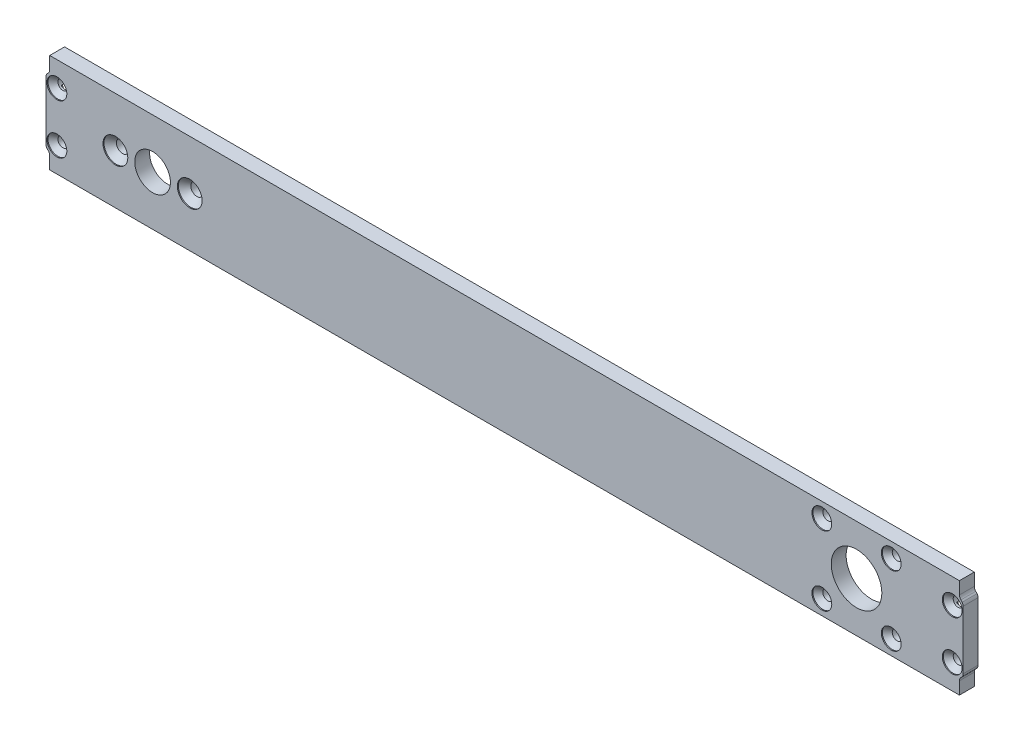
from build123d import *
from build123d.topology import SkipClean

# Parameters (mm, degrees)
SKETCH1_W                    = 185
SKETCH1_H                    = 20
BASE_SHAPE_DEPTH             = 3
MOTOR_CUTOUTS_REACH          = 95.087
SKETCH2_R                    = 1.25
SKETCH2_R_2                  = 3.6
SKETCH2_R_3                  = 5.1
SKETCH2_R_4                  = 1
PCB_SLOT_DEPTH               = 0.775
END_PLATE_HOLES_REACH        = 95.087
SKETCH6_R                    = 1
M2_5_COUNTERSUNKS_AT_2_COUNT = 2
M2_5_COUNTERSUNKS_AT_2_PITCH = 15
M2_COUNTERSUNKS_AT_2_COUNT   = 2
M2_COUNTERSUNKS_AT_2_PITCH   = 10
M2_COUNTERSUNKS_AT_3_COUNT   = 2
M2_COUNTERSUNKS_AT_3_PITCH   = 180.6
M2_COUNTERSUNKS_AT_4_COUNT   = 2
M2_COUNTERSUNKS_AT_4_PITCH   = 180.876643047
M2_COUNTERSUNKS_AT_5_COUNT   = 2
M2_COUNTERSUNKS_AT_5_PITCH   = 17.18400419
M2_COUNTERSUNKS_AT_6_COUNT   = 2
M2_COUNTERSUNKS_AT_6_PITCH   = 28.908303305
M2_COUNTERSUNKS_AT_7_COUNT   = 2
M2_COUNTERSUNKS_AT_7_PITCH   = 26.375936002
M2_COUNTERSUNKS_AT_8_COUNT   = 2
M2_COUNTERSUNKS_AT_8_PITCH   = 12.461540836
TAP_START                    = -1.4
TAP_SLOTS_DEPTH              = 1.4
CUT_EXTRUDE3_REACH           = 95.087
FILLET1_R                    = 1


with BuildPart() as part:
    # Sketch1 → Base shape (new body)
    with BuildSketch(Plane.XY):
        Rectangle(SKETCH1_W, SKETCH1_H)
    extrude(amount=-BASE_SHAPE_DEPTH)

    # Sketch2 → Motor cutouts (cut, up to next)
    with BuildSketch(Plane.XY, mode=Mode.PRIVATE) as motor_cutouts_sk1:
        with Locations((-78.5, 0)):
            Circle(SKETCH2_R)
    motor_cutouts_tool1 = extrude(motor_cutouts_sk1.sketch, amount=-MOTOR_CUTOUTS_REACH, mode=Mode.PRIVATE) & part.part
    # Sketch2 → Motor cutouts (cut, up to next)
    with BuildSketch(Plane.XY, mode=Mode.PRIVATE) as motor_cutouts_sk2:
        with Locations((-63.5, 0)):
            Circle(SKETCH2_R)
    motor_cutouts_tool2 = extrude(motor_cutouts_sk2.sketch, amount=-MOTOR_CUTOUTS_REACH, mode=Mode.PRIVATE) & part.part
    # Sketch2 → Motor cutouts (cut, up to next)
    with BuildSketch(Plane.XY, mode=Mode.PRIVATE) as motor_cutouts_sk3:
        with Locations((-71, 0)):
            Circle(SKETCH2_R_2)
    motor_cutouts_tool3 = extrude(motor_cutouts_sk3.sketch, amount=-MOTOR_CUTOUTS_REACH, mode=Mode.PRIVATE) & part.part
    # Sketch2 → Motor cutouts (cut, up to next)
    with BuildSketch(Plane.XY, mode=Mode.PRIVATE) as motor_cutouts_sk4:
        with Locations((71, 0)):
            Circle(SKETCH2_R_3)
    motor_cutouts_tool4 = extrude(motor_cutouts_sk4.sketch, amount=-MOTOR_CUTOUTS_REACH, mode=Mode.PRIVATE) & part.part
    # Sketch2 → Motor cutouts (cut, up to next)
    with BuildSketch(Plane.XY, mode=Mode.PRIVATE) as motor_cutouts_sk5:
        with Locations((64, 7)):
            Circle(SKETCH2_R_4)
    motor_cutouts_tool5 = extrude(motor_cutouts_sk5.sketch, amount=-MOTOR_CUTOUTS_REACH, mode=Mode.PRIVATE) & part.part
    # Sketch2 → Motor cutouts (cut, up to next)
    with BuildSketch(Plane.XY, mode=Mode.PRIVATE) as motor_cutouts_sk6:
        with Locations((78, 7)):
            Circle(SKETCH2_R_4)
    motor_cutouts_tool6 = extrude(motor_cutouts_sk6.sketch, amount=-MOTOR_CUTOUTS_REACH, mode=Mode.PRIVATE) & part.part
    # Sketch2 → Motor cutouts (cut, up to next)
    with BuildSketch(Plane.XY, mode=Mode.PRIVATE) as motor_cutouts_sk7:
        with Locations((78, -7)):
            Circle(SKETCH2_R_4)
    motor_cutouts_tool7 = extrude(motor_cutouts_sk7.sketch, amount=-MOTOR_CUTOUTS_REACH, mode=Mode.PRIVATE) & part.part
    # Sketch2 → Motor cutouts (cut, up to next)
    with BuildSketch(Plane.XY, mode=Mode.PRIVATE) as motor_cutouts_sk8:
        with Locations((64, -7)):
            Circle(SKETCH2_R_4)
    motor_cutouts_tool8 = extrude(motor_cutouts_sk8.sketch, amount=-MOTOR_CUTOUTS_REACH, mode=Mode.PRIVATE) & part.part
    add(motor_cutouts_tool1.solids().sort_by_distance((-78.5, 0, 0))[0], mode=Mode.SUBTRACT)
    add(motor_cutouts_tool2.solids().sort_by_distance((-63.5, 0, 0))[0], mode=Mode.SUBTRACT)
    add(motor_cutouts_tool3.solids().sort_by_distance((-71, 0, 0))[0], mode=Mode.SUBTRACT)
    add(motor_cutouts_tool4.solids().sort_by_distance((71, 0, 0))[0], mode=Mode.SUBTRACT)
    add(motor_cutouts_tool5.solids().sort_by_distance((64, 7, 0))[0], mode=Mode.SUBTRACT)
    add(motor_cutouts_tool6.solids().sort_by_distance((78, 7, 0))[0], mode=Mode.SUBTRACT)
    add(motor_cutouts_tool7.solids().sort_by_distance((78, -7, 0))[0], mode=Mode.SUBTRACT)
    add(motor_cutouts_tool8.solids().sort_by_distance((64, -7, 0))[0], mode=Mode.SUBTRACT)

    # Sketch5 → PCB slot (cut)
    with BuildSketch(Plane(origin=(0, 0, -3), x_dir=(-1, 0, 0), z_dir=(0, 0, -1))):
        with BuildLine():
            Line((-60, -6), (60, -6))
            ThreePointArc((60, -6), (61, -7), (60, -8))
            Line((60, -8), (-60, -8))
            ThreePointArc((-60, -8), (-61, -7), (-60, -6))
        make_face()
    extrude(amount=-PCB_SLOT_DEPTH, mode=Mode.SUBTRACT)

    # Sketch6 → End plate holes (cut, up to next)
    with BuildSketch(Plane.XY, mode=Mode.PRIVATE) as end_plate_holes_sk1:
        with Locations((90.3, 5)):
            Circle(SKETCH6_R)
    end_plate_holes_tool1 = extrude(end_plate_holes_sk1.sketch, amount=-END_PLATE_HOLES_REACH, mode=Mode.PRIVATE) & part.part
    # Sketch6 → End plate holes (cut, up to next)
    with BuildSketch(Plane.XY, mode=Mode.PRIVATE) as end_plate_holes_sk2:
        with Locations((90.3, -5)):
            Circle(SKETCH6_R)
    end_plate_holes_tool2 = extrude(end_plate_holes_sk2.sketch, amount=-END_PLATE_HOLES_REACH, mode=Mode.PRIVATE) & part.part
    # Sketch6 → End plate holes (cut, up to next)
    with BuildSketch(Plane.XY, mode=Mode.PRIVATE) as end_plate_holes_sk3:
        with Locations((-90.3, -5)):
            Circle(SKETCH6_R)
    end_plate_holes_tool3 = extrude(end_plate_holes_sk3.sketch, amount=-END_PLATE_HOLES_REACH, mode=Mode.PRIVATE) & part.part
    # Sketch6 → End plate holes (cut, up to next)
    with BuildSketch(Plane.XY, mode=Mode.PRIVATE) as end_plate_holes_sk4:
        with Locations((-90.3, 5)):
            Circle(SKETCH6_R)
    end_plate_holes_tool4 = extrude(end_plate_holes_sk4.sketch, amount=-END_PLATE_HOLES_REACH, mode=Mode.PRIVATE) & part.part
    add(end_plate_holes_tool1.solids().sort_by_distance((90.3, 5, 0))[0], mode=Mode.SUBTRACT)
    add(end_plate_holes_tool2.solids().sort_by_distance((90.3, -5, 0))[0], mode=Mode.SUBTRACT)
    add(end_plate_holes_tool3.solids().sort_by_distance((-90.3, -5, 0))[0], mode=Mode.SUBTRACT)
    add(end_plate_holes_tool4.solids().sort_by_distance((-90.3, 5, 0))[0], mode=Mode.SUBTRACT)

    # Sketch4 → M2.5 countersunks (revolve, cut)
    with BuildSketch(Plane(origin=(-78.5, 0, 0), x_dir=(0, -1, 0), z_dir=(1, 0, 0))):
        Polygon((0, 0), (0, 3), (1.25, 3), (1.25, 1.45), (2.5, 0.2), (2.5, 0), align=None)
    m2_5_countersunks = revolve(axis=Axis((-78.5, 0, 6.35), (0, 0, -1)), mode=Mode.SUBTRACT)

    # M2.5 countersunks at 2: M2.5 countersunks ×2
    with Locations(*[(i * M2_5_COUNTERSUNKS_AT_2_PITCH, 0, 0) for i in range(1, M2_5_COUNTERSUNKS_AT_2_COUNT)]):
        add(m2_5_countersunks, mode=Mode.SUBTRACT)

    # Sketch9 → M2 countersunks (revolve, cut)
    with BuildSketch(Plane(origin=(90.3, 5, 0), x_dir=(0, -1, 0), z_dir=(1, 0, 0))):
        Polygon((0, 0), (0, 3), (1, 3), (1, 1.2), (2, 0.2), (2, 0), align=None)
    m2_countersunks = revolve(axis=Axis((90.3, 5, 6.35), (0, 0, -1)), mode=Mode.SUBTRACT)

    # M2 countersunks at 2: M2 countersunks ×2
    with Locations(*[(0, -i * M2_COUNTERSUNKS_AT_2_PITCH, 0) for i in range(1, M2_COUNTERSUNKS_AT_2_COUNT)]):
        add(m2_countersunks, mode=Mode.SUBTRACT)

    # M2 countersunks at 3: M2 countersunks ×2
    with Locations(*[(-i * M2_COUNTERSUNKS_AT_3_PITCH, 0, 0) for i in range(1, M2_COUNTERSUNKS_AT_3_COUNT)]):
        add(m2_countersunks, mode=Mode.SUBTRACT)

    # M2 countersunks at 4: M2 countersunks ×2
    with Locations(*[Vector(-0.9984705430039356, -0.055286298062233535, 0) * (i * M2_COUNTERSUNKS_AT_4_PITCH) for i in range(1, M2_COUNTERSUNKS_AT_4_COUNT)]):
        add(m2_countersunks, mode=Mode.SUBTRACT)

    # M2 countersunks at 5: M2 countersunks ×2
    with Locations(*[Vector(-0.7157819483772108, -0.6983238520753275, 0) * (i * M2_COUNTERSUNKS_AT_5_PITCH) for i in range(1, M2_COUNTERSUNKS_AT_5_COUNT)]):
        add(m2_countersunks, mode=Mode.SUBTRACT)

    # M2 countersunks at 6: M2 countersunks ×2
    with Locations(*[Vector(-0.9097732136717974, -0.4151056488236338, 0) * (i * M2_COUNTERSUNKS_AT_6_PITCH) for i in range(1, M2_COUNTERSUNKS_AT_6_COUNT)]):
        add(m2_countersunks, mode=Mode.SUBTRACT)

    # M2 countersunks at 7: M2 countersunks ×2
    with Locations(*[Vector(-0.9971210120337703, 0.07582669293032472, 0) * (i * M2_COUNTERSUNKS_AT_7_PITCH) for i in range(1, M2_COUNTERSUNKS_AT_7_COUNT)]):
        add(m2_countersunks, mode=Mode.SUBTRACT)

    # M2 countersunks at 8: M2 countersunks ×2
    with Locations(*[Vector(-0.9870368489870532, 0.1604937965832608, 0) * (i * M2_COUNTERSUNKS_AT_8_PITCH) for i in range(1, M2_COUNTERSUNKS_AT_8_COUNT)]):
        add(m2_countersunks, mode=Mode.SUBTRACT)

    # Sketch12 → Tap slots (cut)
    with SkipClean():  # the faces are left unmerged after this step: merging them gives an invalid solid
        with BuildSketch(Plane(origin=(0, 0, -3), x_dir=(-1, 0, 0), z_dir=(0, 0, -1)).offset(TAP_START)):
            with BuildLine():
                Line((-91.9, 2.635786438), (-91.9, -2.635786438))
                ThreePointArc((-91.9, -2.635786438), (-92.085607903, -3.793515558), (-91.043923255, -4.33173494))
                ThreePointArc((-91.043923255, -4.33173494), (-91.048881163, -4.337295689), (-91.053797505, -4.342893219))
                Line((-91.053797505, -4.342893219), (-89.546202495, -4.342893219))
                ThreePointArc((-89.546202495, -4.342893219), (-89.551118837, -4.337295689), (-89.556076745, -4.33173494))
                ThreePointArc((-89.556076745, -4.33173494), (-88.514392097, -3.793515558), (-88.7, -2.635786438))
                Line((-88.7, -2.635786438), (-88.7, 2.635786438))
                ThreePointArc((-88.7, 2.635786438), (-88.514392097, 3.793515558), (-89.556076745, 4.33173494))
                ThreePointArc((-89.556076745, 4.33173494), (-89.551118837, 4.337295689), (-89.546202495, 4.342893219))
                Line((-89.546202495, 4.342893219), (-91.053797505, 4.342893219))
                ThreePointArc((-91.053797505, 4.342893219), (-91.048881163, 4.337295689), (-91.043923255, 4.33173494))
                ThreePointArc((-91.043923255, 4.33173494), (-92.085607903, 3.793515558), (-91.9, 2.635786438))
            make_face()
            with BuildLine():
                Line((91.9, -2.635786438), (91.9, 2.635786438))
                ThreePointArc((91.9, 2.635786438), (92.085607903, 3.793515558), (91.043923255, 4.33173494))
                ThreePointArc((91.043923255, 4.33173494), (91.048881163, 4.337295689), (91.053797505, 4.342893219))
                Line((91.053797505, 4.342893219), (89.546202495, 4.342893219))
                ThreePointArc((89.546202495, 4.342893219), (89.551118837, 4.337295689), (89.556076745, 4.33173494))
                ThreePointArc((89.556076745, 4.33173494), (88.514392097, 3.793515558), (88.7, 2.635786438))
                Line((88.7, 2.635786438), (88.7, -2.635786438))
                ThreePointArc((88.7, -2.635786438), (88.514392097, -3.793515558), (89.556076745, -4.33173494))
                ThreePointArc((89.556076745, -4.33173494), (89.551118837, -4.337295689), (89.546202495, -4.342893219))
                Line((89.546202495, -4.342893219), (91.053797505, -4.342893219))
                ThreePointArc((91.053797505, -4.342893219), (91.048881163, -4.337295689), (91.043923255, -4.33173494))
                ThreePointArc((91.043923255, -4.33173494), (92.085607903, -3.793515558), (91.9, -2.635786438))
            make_face()
        extrude(amount=TAP_SLOTS_DEPTH, mode=Mode.SUBTRACT)

    # Sketch13 → Cut-Extrude3 (cut, up to next)
    with BuildSketch(Plane.XY, mode=Mode.PRIVATE) as cut_extrude3_sk1:
        with BuildLine():
            Line((-91.75, 10), (-92.5, 10))
            Line((-92.5, 10), (-92.5, 6.187434209))
            ThreePointArc((-92.5, 6.187434209), (-92.173731748, 6.655031521), (-91.75, 7.036541185))
            Line((-91.75, 7.036541185), (-91.75, 10))
        make_face()
    cut_extrude3_tool1 = extrude(cut_extrude3_sk1.sketch, amount=-CUT_EXTRUDE3_REACH, mode=Mode.PRIVATE) & part.part
    # Sketch13 → Cut-Extrude3 (cut, up to next)
    with BuildSketch(Plane.XY, mode=Mode.PRIVATE) as cut_extrude3_sk2:
        with BuildLine():
            Line((92.5, 10), (91.75, 10))
            Line((91.75, 10), (91.75, 7.036541185))
            ThreePointArc((91.75, 7.036541185), (92.173731748, 6.655031521), (92.5, 6.187434209))
            Line((92.5, 6.187434209), (92.5, 10))
        make_face()
    cut_extrude3_tool2 = extrude(cut_extrude3_sk2.sketch, amount=-CUT_EXTRUDE3_REACH, mode=Mode.PRIVATE) & part.part
    # Sketch13 → Cut-Extrude3 (cut, up to next)
    with BuildSketch(Plane.XY, mode=Mode.PRIVATE) as cut_extrude3_sk3:
        with BuildLine():
            ThreePointArc((-91.75, -7.036541185), (-92.173731748, -6.655031521), (-92.5, -6.187434209))
            Line((-92.5, -6.187434209), (-92.5, -10))
            Line((-92.5, -10), (-91.75, -10))
            Line((-91.75, -10), (-91.75, -7.036541185))
        make_face()
    cut_extrude3_tool3 = extrude(cut_extrude3_sk3.sketch, amount=-CUT_EXTRUDE3_REACH, mode=Mode.PRIVATE) & part.part
    # Sketch13 → Cut-Extrude3 (cut, up to next)
    with BuildSketch(Plane.XY, mode=Mode.PRIVATE) as cut_extrude3_sk4:
        with BuildLine():
            ThreePointArc((92.5, -6.187434209), (92.173731748, -6.655031521), (91.75, -7.036541185))
            Line((91.75, -7.036541185), (91.75, -10))
            Line((91.75, -10), (92.5, -10))
            Line((92.5, -10), (92.5, -6.187434209))
        make_face()
    cut_extrude3_tool4 = extrude(cut_extrude3_sk4.sketch, amount=-CUT_EXTRUDE3_REACH, mode=Mode.PRIVATE) & part.part
    add(cut_extrude3_tool1.solids().sort_by_distance((-92.140588, 8.330084, 0))[0], mode=Mode.SUBTRACT)
    add(cut_extrude3_tool2.solids().sort_by_distance((92.140588, 8.330084, 0))[0], mode=Mode.SUBTRACT)
    add(cut_extrude3_tool3.solids().sort_by_distance((-92.140588, -8.330084, 0))[0], mode=Mode.SUBTRACT)
    add(cut_extrude3_tool4.solids().sort_by_distance((92.140588, -8.330084, 0))[0], mode=Mode.SUBTRACT)

    # Fillet1
    fillet1_edges = [part.edges().sort_by_distance(p)[0] for p in [
        (-91.75, -7.036541185, -1.5),
        (-92.5, -6.187434209, -1.5),
        (-92.5, 6.187434209, -1.5),
        (-91.75, 7.036541185, -1.5),
        (92.5, 6.187434209, -1.5),
        (91.75, 7.036541185, -1.5),
        (92.5, -6.187434209, -1.5),
        (91.75, -7.036541185, -1.5),
    ]]
    fillet(fillet1_edges, radius=FILLET1_R)


solid = part.part
